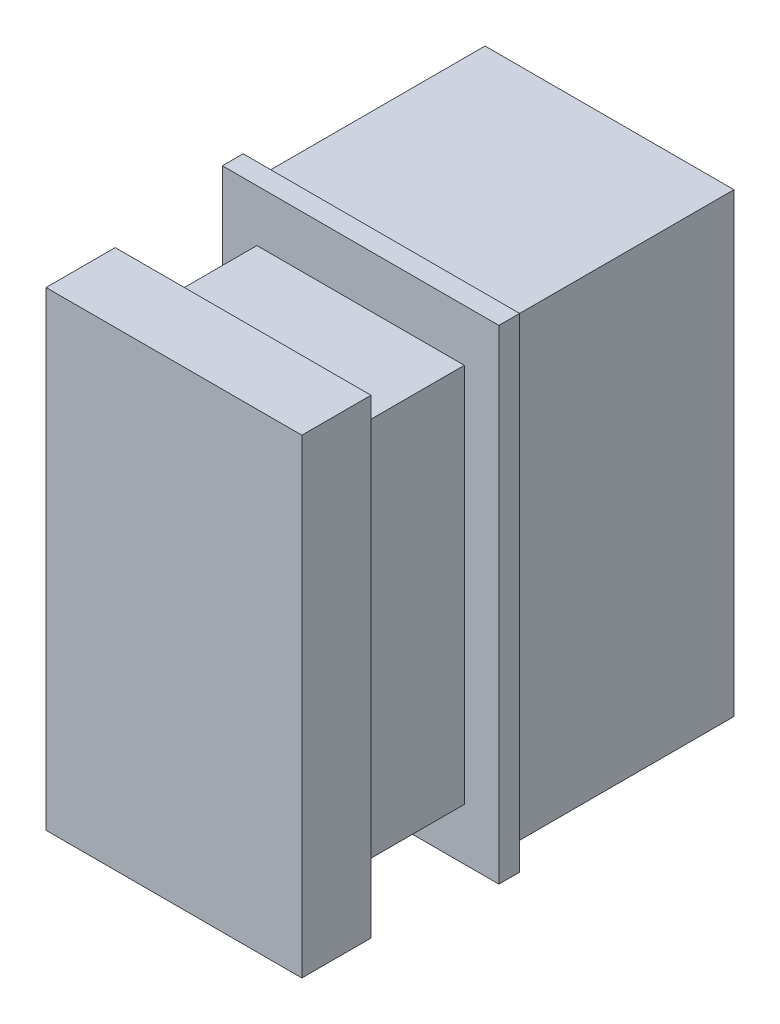
from build123d import *

# Parameters (mm, degrees)
SCHIZZO1_W                   = 4
SCHIZZO1_H                   = 7
ESTRUSIONE_ESTRUSIONE1_DEPTH = 0.3
SCHIZZO2_W                   = 3.6
SCHIZZO2_H                   = 6.6
ESTRUSIONE_ESTRUSIONE2_DEPTH = 3.3
SCHIZZO3_W                   = 3.2
SCHIZZO3_H                   = 6.2
TAGLIO_ESTRUSIONE1_DEPTH     = 9.71148667
SCHIZZO6_W                   = 3
SCHIZZO6_H                   = 5.5
ESTRUSIONE_ESTRUSIONE3_DEPTH = 2
SCHIZZO7_W                   = 3.7
SCHIZZO7_H                   = 6.8
ESTRUSIONE_ESTRUSIONE4_DEPTH = 1


with BuildPart() as part:
    # Schizzo1 → Estrusione-Estrusione1 (new body)
    with BuildSketch(Plane.XY):
        with Locations((2, 3.5)):
            Rectangle(SCHIZZO1_W, SCHIZZO1_H)
    extrude(amount=ESTRUSIONE_ESTRUSIONE1_DEPTH)

    # Schizzo2 → Estrusione-Estrusione2 (add)
    with BuildSketch(Plane.XY):
        with Locations((2, 3.5)):
            Rectangle(SCHIZZO2_W, SCHIZZO2_H)
    extrude(amount=-ESTRUSIONE_ESTRUSIONE2_DEPTH)

    # Schizzo3 → Taglio-Estrusione1 (cut, through all)
    with BuildSketch(Plane.XY):
        with Locations((2, 3.5)):
            Rectangle(SCHIZZO3_W, SCHIZZO3_H)
    extrude(amount=-TAGLIO_ESTRUSIONE1_DEPTH, mode=Mode.SUBTRACT)

    # Schizzo6 → Estrusione-Estrusione3 (add)
    with BuildSketch(Plane.XY):
        with Locations((2, 3.5)):
            Rectangle(SCHIZZO6_W, SCHIZZO6_H)
    extrude(amount=ESTRUSIONE_ESTRUSIONE3_DEPTH)

    # Schizzo7 → Estrusione-Estrusione4 (add)
    with BuildSketch(Plane.XY.offset(2)):
        with Locations((2, 3.5)):
            Rectangle(SCHIZZO7_W, SCHIZZO7_H)
    extrude(amount=ESTRUSIONE_ESTRUSIONE4_DEPTH)


solid = part.part
